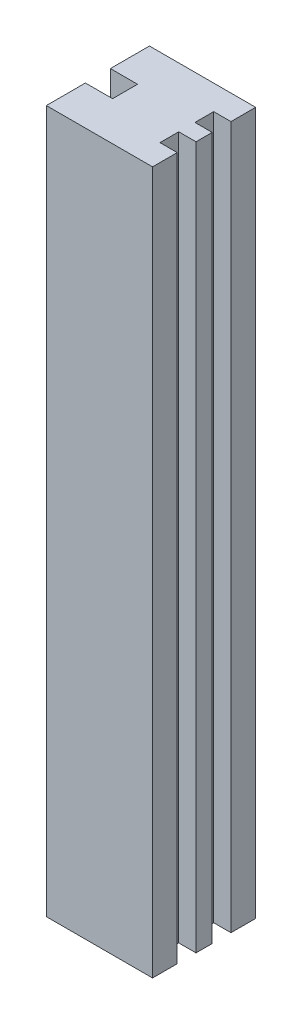
from build123d import *

# Parameters (mm, degrees)
EXTRUDE_1_DEPTH = 205.74


with BuildPart() as part:
    # Эскиз1 → Бобышка-Вытянуть1 (new body)
    with BuildSketch(Plane(origin=(0, 0, 0), x_dir=(1, 0, 0), z_dir=(0, 1, 0))):
        Polygon((0, 3.657663655), (0, -3.657663655), (-7.956991175, -3.657663655), (-7.956991175, -15.100199162), (23.147610692, -15.100199162), (23.147610692, -7.866570821), (18.090813442, -7.866570821), (18.090813442, -2.372011956), (23.147610692, -2.372011956), (23.147610692, 2.372011956), (18.090813442, 2.372011956), (18.090813442, 7.866570821), (23.147610692, 7.866570821), (23.147610692, 15.100199162), (-7.956991175, 15.100199162), (-7.956991175, 3.657663655), align=None)
    extrude(amount=EXTRUDE_1_DEPTH)


solid = part.part
